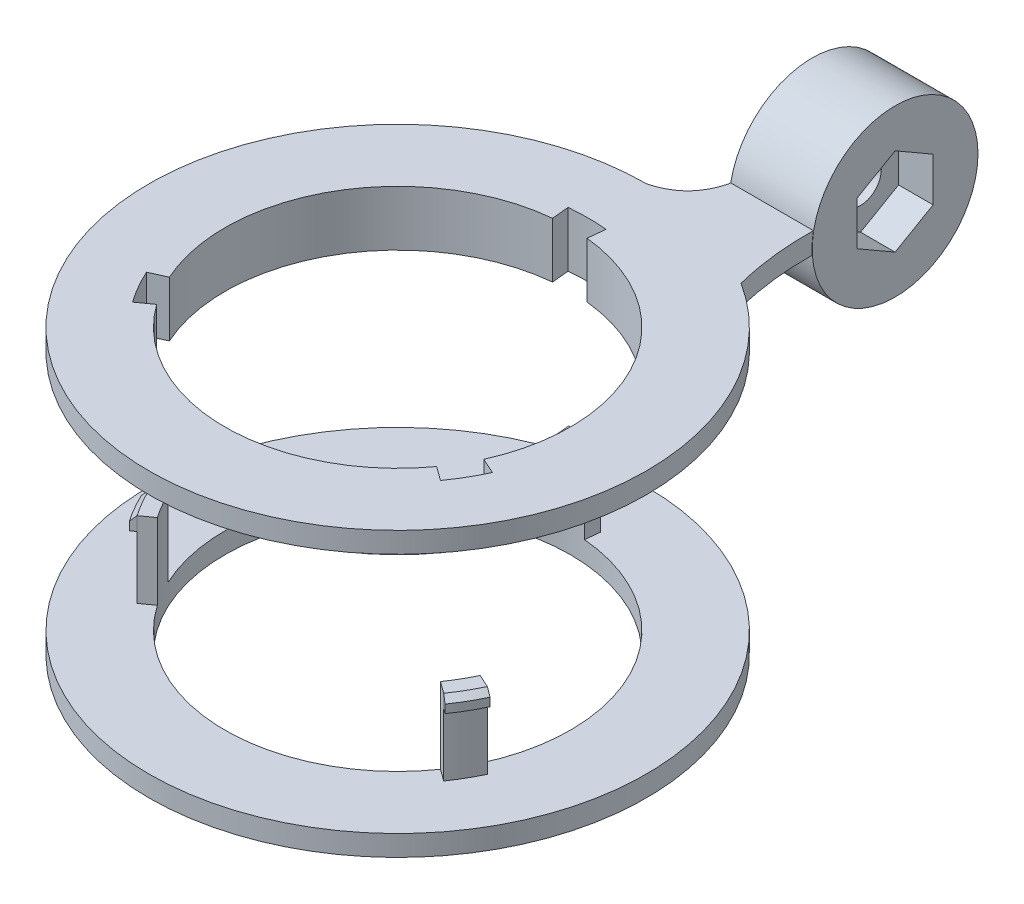
from build123d import *
from build123d.topology import SkipClean

# Parameters (mm, degrees)
ESBO_O120_R                = 6
RESSALTO_EXTRUS_O39_DEPTH  = 6
ESBO_O120_3_W              = 10
ESBO_O120_3_H              = 0.75
ESBO_O120_3_W_2            = 0.75
ESBO_O120_3_H_2            = 10
CORTE_EXTRUS_O_FINA1_DEPTH = 0.4
CORTE_EXTRUS_O49_REACH     = 205.931
ESBO_O120_4_R              = 1.5
CORTE_EXTRUS_O50_DEPTH     = 2.5
RESSALTO_EXTRUS_O40_DEPTH  = 1.5
RESSALTO_EXTRUS_O41_START  = -2.5
ESBO_O122_12_R             = 14.5
RESSALTO_EXTRUS_O41_DEPTH  = 2.5
ESBO_O123_R                = 18
ESBO_O123_R_2              = 12.5
RESSALTO_EXTRUS_O42_DEPTH  = 1.5
RESSALTO_EXTRUS_O43_DEPTH  = 5.5
RESSALTO_EXTRUS_O44_DEPTH  = 1
CHANFRO1_SIZE              = 0.4


with BuildPart() as part:
    # Esboço120 → Ressalto-extrusão39 (new body)
    with BuildSketch(Plane(origin=(10, 0, 0), x_dir=(0, 0, -1), z_dir=(1, 0, 0))):
        with Locations((-76, 180.622055231)):
            Circle(ESBO_O120_R)
    extrude(amount=RESSALTO_EXTRUS_O39_DEPTH)

    # Esboço120<3> → Corte-Extrusão-Fina1 (cut)
    with BuildSketch(Plane(origin=(10, 0, 0), x_dir=(0, 0, -1), z_dir=(1, 0, 0))):
        Polygon((-78.824759526, 184.76468225), (-73.824759526, 176.104428212), (-73.175240474, 176.479428212), (-78.175240474, 185.13968225), align=None)
        Polygon((-78.175240474, 176.104428212), (-73.175240474, 184.76468225), (-73.824759526, 185.13968225), (-78.824759526, 176.479428212), align=None)
        Polygon((-80.142627019, 177.797295704), (-71.482372981, 182.797295704), (-71.857372981, 183.446814757), (-80.517627019, 178.446814757), align=None)
        with Locations((-76, 180.622055231)):
            Rectangle(ESBO_O120_3_W, ESBO_O120_3_H)
        Polygon((-71.482372981, 178.446814757), (-80.142627019, 183.446814757), (-80.517627019, 182.797295704), (-71.857372981, 177.797295704), align=None)
        with Locations((-76, 180.622055231)):
            Rectangle(ESBO_O120_3_W_2, ESBO_O120_3_H_2)
    extrude(amount=CORTE_EXTRUS_O_FINA1_DEPTH, mode=Mode.SUBTRACT)

    # Esboço120<4> → Corte-extrusão49 (cut, up to next)
    with BuildSketch(Plane(origin=(10, 0, 0), x_dir=(0, 0, -1), z_dir=(1, 0, 0)), mode=Mode.PRIVATE) as corte_extrus_o49_sk1:
        with Locations(Location((-76, 180.622055231, 0), (0, 0, 165.522487814))):
            Circle(ESBO_O120_4_R)
    corte_extrus_o49_tool1 = extrude(corte_extrus_o49_sk1.sketch, amount=CORTE_EXTRUS_O49_REACH, mode=Mode.PRIVATE) & part.part
    add(corte_extrus_o49_tool1.solids().sort_by_distance((10, 180.622055, 76))[0], mode=Mode.SUBTRACT)

    # Esboço121 → Corte-extrusão50 (cut)
    with BuildSketch(Plane(origin=(16, 0, 0), x_dir=(0, 0, -1), z_dir=(1, 0, 0))):
        Polygon((-76, 183.797481711), (-78.75, 182.209768471), (-78.75, 179.03434199), (-76, 177.44662875), (-73.25, 179.03434199), (-73.25, 182.209768471), align=None)
    extrude(amount=-CORTE_EXTRUS_O50_DEPTH, mode=Mode.SUBTRACT)

    # Esboço122 → Ressalto-extrusão40 (add)
    with BuildSketch(Plane(origin=(0, 180.233826663, 0), x_dir=(1, 0, 0), z_dir=(0, 1, 0))):
        with BuildLine():
            Line((10, -81.5), (10, -82))
            add(Edge.make_bspline(
                [(10, -82), (9.391813157, -84.399749478), (7, -85)],
                knots=[0, 0, 0, 1, 1, 1], degree=2))
            ThreePointArc((7, -85), (1.965005041, -120.281459017), (16.66800656, -87.816797138))
            add(Edge.make_bspline(
                [(16, -81.5), (15.870115204, -84.692384764), (16.66800656, -87.816797138)],
                knots=[0, 0, 0, 1, 1, 1], degree=2))
            Line((16, -81.5), (10, -81.5))
        make_face()
        with BuildLine():
            ThreePointArc((8.26925066, -90.564606851), (17.835252837, -96.767240101), (18.387638276, -108.154773952))
            Line((18.387638276, -108.154773952), (19.526402104, -108.670251347))
            ThreePointArc((19.526402104, -108.670251347), (18.896890309, -109.89394669), (18.148215147, -111.048589879))
            Line((18.148215147, -111.048589879), (17.134741043, -110.31689989))
            ThreePointArc((17.134741043, -110.31689989), (6.98010199, -115.499984163), (-3.157984331, -110.28459706))
            Line((-3.157984331, -110.28459706), (-4.173782764, -111.013056766))
            ThreePointArc((-4.173782764, -111.013056766), (-4.918778121, -109.856035889), (-5.544390873, -108.630342585))
            Line((-5.544390873, -108.630342585), (-4.403991703, -108.118493259))
            ThreePointArc((-4.403991703, -108.118493259), (-3.815354827, -96.732775736), (5.770346055, -90.560628988))
            Line((5.770346055, -90.560628988), (5.64738066, -89.316691887))
            ThreePointArc((5.64738066, -89.316691887), (7.021887811, -89.250017421), (8.396175726, -89.321067537))
            Line((8.396175726, -89.321067537), (8.26925066, -90.564606851))
        make_face(mode=Mode.SUBTRACT)
    extrude(amount=RESSALTO_EXTRUS_O40_DEPTH)

    # Esboço122<12> → Ressalto-extrusão41 (add)
    with BuildSketch(Plane(origin=(0, 180.233826663, 0), x_dir=(1, 0, 0), z_dir=(0, 1, 0)).offset(RESSALTO_EXTRUS_O41_START)):
        with Locations(Location((7, -103, 0), (0, 0, 270))):
            Circle(ESBO_O122_12_R)
        with BuildLine():
            Line((8.396175726, -89.321067537), (8.26925066, -90.564606851))
            ThreePointArc((8.26925066, -90.564606851), (16.276735235, -94.621922454), (19.5, -103))
            ThreePointArc((19.5, -103), (19.218745403, -105.636714011), (18.387638276, -108.154773952))
            Line((18.387638276, -108.154773952), (19.526402104, -108.670251347))
            ThreePointArc((19.526402104, -108.670251347), (18.896890309, -109.89394669), (18.148215147, -111.048589879))
            Line((18.148215147, -111.048589879), (17.134741043, -110.31689989))
            ThreePointArc((17.134741043, -110.31689989), (6.98010199, -115.499984163), (-3.157984331, -110.28459706))
            Line((-3.157984331, -110.28459706), (-4.173782764, -111.013056766))
            ThreePointArc((-4.173782764, -111.013056766), (-4.918778121, -109.856035889), (-5.544390873, -108.630342585))
            Line((-5.544390873, -108.630342585), (-4.403991703, -108.118493259))
            ThreePointArc((-4.403991703, -108.118493259), (-3.815354827, -96.732775736), (5.770346055, -90.560628988))
            Line((5.770346055, -90.560628988), (5.64738066, -89.316691887))
            ThreePointArc((5.64738066, -89.316691887), (7.021887811, -89.250017421), (8.396175726, -89.321067537))
        make_face(mode=Mode.SUBTRACT)
    extrude(amount=RESSALTO_EXTRUS_O41_DEPTH)


with BuildPart() as body_2:
    # Esboço123 → Ressalto-extrusão42 (new body)
    with BuildSketch(Plane(origin=(0, 162.733826663, 0), x_dir=(-1, 0, 0), z_dir=(0, -1, 0))):
        with Locations(Location((-7, -103, 0), (0, 0, 90))):
            Circle(ESBO_O123_R)
        with Locations(Location((-7, -103, 0), (0, 0, 90))):
            Circle(ESBO_O123_R_2, mode=Mode.SUBTRACT)
    extrude(amount=RESSALTO_EXTRUS_O42_DEPTH)

    # Esboço123<3> → Ressalto-extrusão43 (add)
    with SkipClean():  # the faces are left unmerged after this step: merging them gives an invalid solid
        with BuildSketch(Plane(origin=(0, 162.733826663, 0), x_dir=(-1, 0, 0), z_dir=(0, -1, 0))):
            with BuildLine():
                ThreePointArc((-17.250514111, -110.15380741), (-17.815354827, -109.267224264), (-18.303704182, -108.336316311))
                Line((-18.303704182, -108.336316311), (-19.260378769, -108.769368461))
                ThreePointArc((-19.260378769, -108.769368461), (-18.723844632, -109.793671102), (-18.101932901, -110.768499589))
                Line((-18.101932901, -110.768499589), (-17.250514111, -110.15380741))
            make_face()
            with BuildLine():
                Line((5.278684444, -108.730306129), (4.320636006, -108.300301917))
                ThreePointArc((4.320636006, -108.300301917), (3.835252837, -109.232759899), (3.273237579, -110.121136823))
                Line((3.273237579, -110.121136823), (4.126609036, -110.733115243))
                ThreePointArc((4.126609036, -110.733115243), (4.745414075, -109.75631173), (5.278684444, -108.730306129))
            make_face()
            with BuildLine():
                Line((-8.176751543, -89.501194282), (-8.070121896, -90.545890673))
                ThreePointArc((-8.070121896, -90.545890673), (-7.01989801, -90.500015837), (-5.969533397, -90.542546866))
                Line((-5.969533397, -90.542546866), (-5.866230267, -89.497516295))
                ThreePointArc((-5.866230267, -89.497516295), (-7.021569443, -89.450017168), (-8.176751543, -89.501194282))
            make_face()
        extrude(amount=-RESSALTO_EXTRUS_O43_DEPTH)

    # Esboço124 → Ressalto-extrusão44 (add)
    with SkipClean():  # the faces are left unmerged after this step: merging them gives an invalid solid
        with BuildSketch(Plane(origin=(0, 168.233826663, 0), x_dir=(1, 0, 0), z_dir=(0, 1, 0))):
            with BuildLine():
                Line((18.101932901, -110.768499589), (18.429665238, -110.99782799))
                ThreePointArc((18.429665238, -110.99782799), (19.069935987, -109.994222278), (19.62230877, -108.939681921))
                Line((19.62230877, -108.939681921), (19.260378769, -108.769368461))
                ThreePointArc((19.260378769, -108.769368461), (18.723844632, -109.793671102), (18.101932901, -110.768499589))
            make_face()
            with BuildLine():
                Line((8.176751543, -89.501194282), (8.211489596, -89.102705553))
                ThreePointArc((8.211489596, -89.102705553), (7.02220618, -89.050017674), (5.832761049, -89.098918991))
                Line((5.832761049, -89.098918991), (5.866230267, -89.497516295))
                ThreePointArc((5.866230267, -89.497516295), (7.021569443, -89.450017168), (8.176751543, -89.501194282))
            make_face()
            with BuildLine():
                Line((-5.278684444, -108.730306129), (-5.641154833, -108.899466458))
                ThreePointArc((-5.641154833, -108.899466458), (-5.092142166, -109.955760047), (-4.455069819, -110.961399088))
                Line((-4.455069819, -110.961399088), (-4.126609036, -110.733115243))
                ThreePointArc((-4.126609036, -110.733115243), (-4.745414075, -109.75631173), (-5.278684444, -108.730306129))
            make_face()
        extrude(amount=-RESSALTO_EXTRUS_O44_DEPTH)

    # Chanfro1
    chanfro1_edges = [body_2.edges().sort_by_distance(p)[0] for p in [
        (19.069935987, 168.233826663, 109.994222278),
        (-5.092142166, 168.233826663, 109.955760047),
        (7.02220618, 168.233826663, 89.050017674),
    ]]
    chamfer(chanfro1_edges, length=CHANFRO1_SIZE - 0.0001)  # a hair under: the kernel refuses the full size


solid = Compound([part.part, body_2.part])
